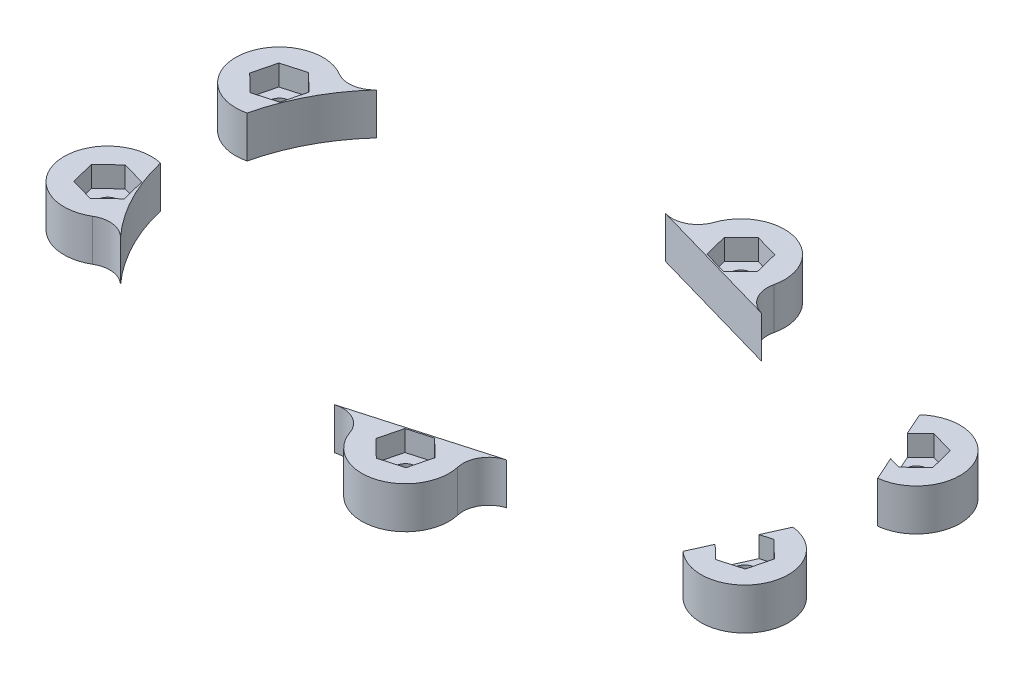
from build123d import *

# Parameters (mm, degrees)
SKETCH1_W               = 200
SKETCH1_H               = 150
SKETCH1_R               = 6
SKETCH1_R_2             = 13.5
SKETCH1_R_3             = 2
SKETCH1_R_4             = 2.5
BOSS_EXTRUDE1_DEPTH     = 4
SKETCH3_W               = 200
SKETCH3_H               = 150
BOSS_EXTRUDE2_DEPTH     = 8.25
SKETCH6_R               = 5.4
CUT_EXTRUDE2_DEPTH      = 8.25
FILLET1_R               = 2.5
FILLET2_R               = 5
SKETCH2_R               = 4.4
SKETCH2_R_2             = 5.4
CUT_EXTRUDE1_DEPTH      = 2
CUT_EXTRUDE3_DEPTH      = 126.598815828
CUT_EXTRUDE3_DEPTH_BACK = 126.598815828
SKETCH8_R               = 2
CUT_EXTRUDE6_DEPTH      = 126.598815818
CUT_EXTRUDE6_DEPTH_BACK = 126.598815818
SKETCH13_OUTSIDE_W      = 252.06
SKETCH13_OUTSIDE_H      = 202.06
FILLET4_R               = 5
CUT_EXTRUDE7_START      = -10.25
CUT_EXTRUDE7_DEPTH      = 10.25
SKETCH17_R              = 2
BOSS_EXTRUDE3_DEPTH     = 2
SKETCH18_R              = 13.5
SKETCH18_R_2            = 2
SKETCH18_R_3            = 2.5
SKETCH18_R_4            = 6
BOSS_EXTRUDE4_DEPTH     = 6
CUT_EXTRUDE8_DEPTH      = 92.336643939
CUT_EXTRUDE8_DEPTH_BACK = 92.336643939
SKETCH19_R              = 19.5
SKETCH19_R_2            = 0.75
CUT_EXTRUDE9_DEPTH      = 4
CUT_EXTRUDE10_DEPTH     = 4
SKETCH22_OUTSIDE_W      = 173.598
SKETCH22_OUTSIDE_H      = 115.598
CUT_EXTRUDE12_DEPTH     = 10


with BuildPart() as part:
    # Sketch1 → Boss-Extrude1 (new body)
    with BuildSketch(Plane(origin=(0, 0, 0), x_dir=(1, 0, 0), z_dir=(0, 1, 0))):
        Rectangle(SKETCH1_W, SKETCH1_H)
        with Locations(Location((35.5, 0, 0), (0, 0, 270))):
            Circle(SKETCH1_R, mode=Mode.SUBTRACT)
        with Locations(Location((-35.5, 0, 0), (0, 0, 270))):
            Circle(SKETCH1_R_2, mode=Mode.SUBTRACT)
        with Locations(Location((-60.5, 0, 0), (0, 0, 270))):
            Circle(SKETCH1_R_3, mode=Mode.SUBTRACT)
        with Locations(Location((-35.5, 25, 0), (0, 0, 270))):
            Circle(SKETCH1_R_3, mode=Mode.SUBTRACT)
        with Locations(Location((-10.5, 0, 0), (0, 0, 270))):
            Circle(SKETCH1_R_3, mode=Mode.SUBTRACT)
        with Locations(Location((-35.5, -25, 0), (0, 0, 270))):
            Circle(SKETCH1_R_3, mode=Mode.SUBTRACT)
        with Locations(Location((35.5, 18.5, 0), (0, 0, 270))):
            Circle(SKETCH1_R_4, mode=Mode.SUBTRACT)
        with Locations(Location((35.5, -18.5, 0), (0, 0, 90))):
            Circle(SKETCH1_R_4, mode=Mode.SUBTRACT)
        Polygon((4.517711304, -15.136418767), (0.159242352, 0.258507293), (4.681501882, 1.538807548), (9.039970835, -13.856118512), (9.584779454, -15.78048427), (5.062519924, -17.060784524), align=None, mode=Mode.SUBTRACT)
    extrude(amount=BOSS_EXTRUDE1_DEPTH)

    # Sketch3 → Boss-Extrude2 (add)
    with BuildSketch(Plane(origin=(0, 4, 0), x_dir=(1, 0, 0), z_dir=(0, 1, 0))):
        Rectangle(SKETCH3_W, SKETCH3_H)
        with BuildLine():
            Line((-26.573943662, 31.250208291), (39.070422535, 12.500083317))
            ThreePointArc((39.070422535, 12.500083317), (48.5, 0), (39.070422535, -12.500083317))
            Line((39.070422535, -12.500083317), (-26.573943662, -31.250208291))
            ThreePointArc((-26.573943662, -31.250208291), (-68, 0), (-26.573943662, 31.250208291))
        make_face(mode=Mode.SUBTRACT)
    extrude(amount=BOSS_EXTRUDE2_DEPTH)

    # Sketch6 → Cut-Extrude2 (cut)
    with BuildSketch(Plane(origin=(0, 12.25, 0), x_dir=(1, 0, 0), z_dir=(0, 1, 0))):
        with Locations((35.5, 18.5)):
            Circle(SKETCH6_R)
        with Locations((35.5, -18.5)):
            Circle(SKETCH6_R)
    extrude(amount=-CUT_EXTRUDE2_DEPTH, mode=Mode.SUBTRACT)

    # Fillet1
    # the kernel refuses this fillet: 2.5 mm, written as the material it adds along each edge
    with BuildSketch(Plane(origin=(9.584779454, 0, 15.78048427), x_dir=(-0.9621828787440704, 0, 0.2724043095323078), z_dir=(0, 1, 0)), Plane(origin=(5.062519924, 0, 17.060784524), x_dir=(-0.2724043095323296, 0, -0.9621828787440644), z_dir=(0, 1, 0)), Plane(origin=(4.681501882, 0, -1.538807548), x_dir=(0.2724043095323091, 0, 0.96218287874407), z_dir=(0, 1, 0))) as fillet1_piece_1:
        with BuildLine():
            CenterArc((FILLET1_R, -FILLET1_R), FILLET1_R, 90, 90)
            Line((0, -FILLET1_R), (0, 0))
            Line((0, 0), (FILLET1_R, 0))
        make_face()
    extrude(amount=4)
    with BuildSketch(Plane(origin=(0.159242352, 0, -0.258507293), x_dir=(0.272404309532306, 0, 0.962182878744071), z_dir=(0, 1, 0))) as fillet1_piece_2:
        with BuildLine():
            CenterArc((FILLET1_R, FILLET1_R), FILLET1_R, 180, 90)
            Line((0, FILLET1_R), (0, 0))
            Line((0, 0), (FILLET1_R, 0))
        make_face()
    extrude(amount=4)

    # Fillet2
    fillet2_edges = [part.edges().sort_by_distance(p)[0] for p in [
        (31.784909874, 8.125, 14.581058133),
        (36.584743308, 8.125, 13.210072594),
        (36.584743308, 8.125, -13.210072594),
        (31.784909874, 8.125, -14.581058133),
    ]]
    fillet(fillet2_edges, radius=FILLET2_R)

    # Sketch2 → Cut-Extrude1 (cut)
    with BuildSketch(Plane(origin=(0, 4, 0), x_dir=(1, 0, 0), z_dir=(0, 1, 0))):
        with Locations(Location((-35.5, 25, 0), (0, 0, 270))):
            Circle(SKETCH2_R)
        with Locations(Location((-10.5, 0, 0), (0, 0, 270))):
            Circle(SKETCH2_R)
        with Locations(Location((-35.5, -25, 0), (0, 0, 270))):
            Circle(SKETCH2_R)
        with Locations(Location((-60.5, 0, 0), (0, 0, 270))):
            Circle(SKETCH2_R)
        with Locations(Location((35.5, 18.5, 0), (0, 0, 270))):
            Circle(SKETCH2_R_2)
        with Locations(Location((35.5, -18.5, 0), (0, 0, 197.105868404))):
            Circle(SKETCH2_R_2)
    extrude(amount=-CUT_EXTRUDE1_DEPTH, mode=Mode.SUBTRACT)

    # Sketch8 → Cut-Extrude3 (cut, two sides: drawn at the far end of the back side and taken through both)
    with BuildSketch(Plane.XZ.offset(-CUT_EXTRUDE3_DEPTH_BACK)):
        with Locations(Location((49.5, 16.5, 0), (0, 0, 270))):
            Circle(SKETCH8_R)
        with Locations(Location((-73, 16.5, 0), (0, 0, 270))):
            Circle(SKETCH8_R)
        with Locations(Location((0, 32.25, 0), (0, 0, 270))):
            Circle(SKETCH8_R)
        with Locations(Location((-73, -16.5, 0), (0, 0, 270))):
            Circle(SKETCH8_R)
        with Locations(Location((0, -32.25, 0), (0, 0, 270))):
            Circle(SKETCH8_R)
        with Locations(Location((49.5, -16.5, 0), (0, 0, 270))):
            Circle(SKETCH8_R)
    extrude(amount=CUT_EXTRUDE3_DEPTH + CUT_EXTRUDE3_DEPTH_BACK, mode=Mode.SUBTRACT)

    # Sketch13 outside → Cut-Extrude6 (cut, two sides: drawn at the far end of the back side and taken through both)
    with BuildSketch(Plane(origin=(0, 12.25, 0), x_dir=(1, 0, 0), z_dir=(0, 1, 0)).offset(-CUT_EXTRUDE6_DEPTH_BACK)):
        Rectangle(SKETCH13_OUTSIDE_W, SKETCH13_OUTSIDE_H)
        with BuildLine():
            Line((-8.131291348, 30.142370761), (-25.475352113, 35.096387773))
            ThreePointArc((-25.475352113, 35.096387773), (-47.910899113, 34.325203324), (-65.651791262, 20.569868344))
            ThreePointArc((-65.651791262, 20.569868344), (-80.688646272, 19.88300436), (-71.036099712, 8.332803684))
            ThreePointArc((-71.036099712, 8.332803684), (-72, 0), (-71.036099712, -8.332803684))
            ThreePointArc((-71.036099712, -8.332803684), (-80.688646272, -19.88300436), (-65.651791262, -20.569868344))
            ThreePointArc((-65.651791262, -20.569868344), (-47.910899113, -34.325203324), (-25.475352113, -35.096387773))
            Line((-25.475352113, -35.096387773), (-8.131291348, -30.142370761))
            ThreePointArc((-8.131291348, -30.142370761), (2.307042254, -40.326976912), (5.791389082, -26.165609111))
            Line((5.791389082, -26.165609111), (25.285418022, -20.597492606))
            ThreePointArc((25.285418022, -20.597492606), (26.036864948, -20.680025145), (26.515828803, -21.264899257))
            ThreePointArc((26.515828803, -21.264899257), (34.700336728, -27.865924335), (43.885416553, -22.74791587))
            ThreePointArc((43.885416553, -22.74791587), (57.167099831, -19.931556524), (50.418811796, -8.150402112))
            ThreePointArc((50.418811796, -8.150402112), (52.5, 0), (50.418811796, 8.150402112))
            ThreePointArc((50.418811796, 8.150402112), (57.167099831, 19.931556524), (43.885416553, 22.74791587))
            ThreePointArc((43.885416553, 22.74791587), (34.700336728, 27.865924335), (26.515828803, 21.264899257))
            ThreePointArc((26.515828803, 21.264899257), (26.036864948, 20.680025145), (25.285418022, 20.597492606))
            Line((25.285418022, 20.597492606), (5.791389082, 26.165609111))
            ThreePointArc((5.791389082, 26.165609111), (2.307042254, 40.326976912), (-8.131291348, 30.142370761))
        make_face(mode=Mode.SUBTRACT)
    extrude(amount=CUT_EXTRUDE6_DEPTH + CUT_EXTRUDE6_DEPTH_BACK, mode=Mode.SUBTRACT)

    # Fillet4
    fillet4_edges = [part.edges().sort_by_distance(p)[0] for p in [
        (-65.651791262, 6.125, -20.569868344),
        (-8.131291348, 6.125, -30.142370761),
        (5.791389082, 6.125, -26.165609111),
        (5.791389082, 6.125, 26.165609111),
        (-8.131291348, 6.125, 30.142370761),
        (-65.651791262, 6.125, 20.569868344),
    ]]
    fillet(fillet4_edges, radius=FILLET4_R)

    # Sketch16 → Cut-Extrude7 (cut)
    with BuildSketch(Plane(origin=(0, 12.25, 0), x_dir=(1, 0, 0), z_dir=(0, 1, 0)).offset(CUT_EXTRUDE7_START)):
        with BuildLine():
            Line((-25.475352113, -35.096387773), (-14.034980843, -31.828652803))
            ThreePointArc((-14.034980843, -31.828652803), (-10.35487685, -32.200345605), (-7.937211031, -34.999669261))
            ThreePointArc((-7.937211031, -34.999669261), (2.307042254, -40.326976912), (8.192079949, -30.392629249))
            ThreePointArc((8.192079949, -30.392629249), (8.766483762, -26.738675062), (11.695078578, -24.479327069))
            Line((11.695078578, -24.479327069), (25.285418022, -20.597492606))
            ThreePointArc((25.285418022, -20.597492606), (26.036864948, -20.680025145), (26.515828803, -21.264899257))
            ThreePointArc((26.515828803, -21.264899257), (34.700336728, -27.865924335), (43.885416553, -22.74791587))
            ThreePointArc((43.885416553, -22.74791587), (57.167099831, -19.931556524), (50.418811796, -8.150402112))
            ThreePointArc((50.418811796, -8.150402112), (52.5, 0), (50.418811796, 8.150402112))
            ThreePointArc((50.418811796, 8.150402112), (57.167099831, 19.931556524), (43.885416553, 22.74791587))
            ThreePointArc((43.885416553, 22.74791587), (34.700336728, 27.865924335), (26.515828803, 21.264899257))
            ThreePointArc((26.515828803, 21.264899257), (26.036864948, 20.680025145), (25.285418022, 20.597492606))
            Line((25.285418022, 20.597492606), (11.695078578, 24.479327069))
            ThreePointArc((11.695078578, 24.479327069), (8.766483762, 26.738675062), (8.192079949, 30.392629249))
            ThreePointArc((8.192079949, 30.392629249), (2.307042254, 40.326976912), (-7.937211031, 34.999669261))
            ThreePointArc((-7.937211031, 34.999669261), (-10.35487685, 32.200345605), (-14.034980843, 31.828652803))
            Line((-14.034980843, 31.828652803), (-25.475352113, 35.096387773))
            ThreePointArc((-25.475352113, 35.096387773), (-45.44485792, 35.119080298), (-62.437574746, 24.629597374))
            ThreePointArc((-62.437574746, 24.629597374), (-65.401208588, 23.05656851), (-68.691961882, 23.711158546))
            ThreePointArc((-68.691961882, 23.711158546), (-81.304080467, 17.765799193), (-71.036099712, 8.332803684))
            ThreePointArc((-71.036099712, 8.332803684), (-72, 0), (-71.036099712, -8.332803684))
            ThreePointArc((-71.036099712, -8.332803684), (-81.304080467, -17.765799193), (-68.691961882, -23.711158546))
            ThreePointArc((-68.691961882, -23.711158546), (-65.401208588, -23.05656851), (-62.437574746, -24.629597374))
            ThreePointArc((-62.437574746, -24.629597374), (-45.44485792, -35.119080298), (-25.475352113, -35.096387773))
        make_face()
    extrude(amount=CUT_EXTRUDE7_DEPTH, mode=Mode.SUBTRACT)

    # Sketch17 → Boss-Extrude3 (add)
    with BuildSketch(Plane.XZ):
        with Locations((-10.5, 0)):
            Circle(SKETCH17_R)
        with Locations((-35.5, -25)):
            Circle(SKETCH17_R)
        with Locations((-35.5, 25)):
            Circle(SKETCH17_R)
        with Locations((-60.5, 0)):
            Circle(SKETCH17_R)
        with BuildLine():
            Line((4.38150915, 14.655327328), (0.840253126, 2.146949904))
            ThreePointArc((0.840253126, 2.146949904), (1.027633585, 0.312624087), (2.421599042, -0.894323694))
            ThreePointArc((2.421599042, -0.894323694), (4.241377267, -0.597221274), (5.362512656, 0.866649649))
            Line((5.362512656, 0.866649649), (8.90376868, 13.375027073))
            ThreePointArc((8.90376868, 13.375027073), (8.71638822, 15.209352889), (7.322422764, 16.41630067))
            ThreePointArc((7.322422764, 16.41630067), (5.502644538, 16.11919825), (4.38150915, 14.655327328))
        make_face()
    extrude(amount=-BOSS_EXTRUDE3_DEPTH)

    # Sketch18 → Boss-Extrude4 (add)
    with BuildSketch(Plane(origin=(0, 2, 0), x_dir=(1, 0, 0), z_dir=(0, 1, 0))):
        with BuildLine():
            Line((-25.475352113, -35.096387773), (-14.034980843, -31.828652803))
            ThreePointArc((-14.034980843, -31.828652803), (-10.35487685, -32.200345605), (-7.937211031, -34.999669261))
            ThreePointArc((-7.937211031, -34.999669261), (2.307042254, -40.326976912), (8.192079949, -30.392629249))
            ThreePointArc((8.192079949, -30.392629249), (8.766483762, -26.738675062), (11.695078578, -24.479327069))
            Line((11.695078578, -24.479327069), (25.285418022, -20.597492606))
            ThreePointArc((25.285418022, -20.597492606), (26.036864948, -20.680025145), (26.515828803, -21.264899257))
            ThreePointArc((26.515828803, -21.264899257), (34.700336728, -27.865924335), (43.885416553, -22.74791587))
            ThreePointArc((43.885416553, -22.74791587), (57.167099831, -19.931556524), (50.418811796, -8.150402112))
            ThreePointArc((50.418811796, -8.150402112), (52.5, 0), (50.418811796, 8.150402112))
            ThreePointArc((50.418811796, 8.150402112), (57.167099831, 19.931556524), (43.885416553, 22.74791587))
            ThreePointArc((43.885416553, 22.74791587), (34.700336728, 27.865924335), (26.515828803, 21.264899257))
            ThreePointArc((26.515828803, 21.264899257), (26.036864948, 20.680025145), (25.285418022, 20.597492606))
            Line((25.285418022, 20.597492606), (11.695078578, 24.479327069))
            ThreePointArc((11.695078578, 24.479327069), (8.766483762, 26.738675062), (8.192079949, 30.392629249))
            ThreePointArc((8.192079949, 30.392629249), (2.307042254, 40.326976912), (-7.937211031, 34.999669261))
            ThreePointArc((-7.937211031, 34.999669261), (-10.35487685, 32.200345605), (-14.034980843, 31.828652803))
            Line((-14.034980843, 31.828652803), (-25.475352113, 35.096387773))
            ThreePointArc((-25.475352113, 35.096387773), (-45.44485792, 35.119080298), (-62.437574746, 24.629597374))
            ThreePointArc((-62.437574746, 24.629597374), (-65.401208588, 23.05656851), (-68.691961882, 23.711158546))
            ThreePointArc((-68.691961882, 23.711158546), (-81.304080467, 17.765799193), (-71.036099712, 8.332803684))
            ThreePointArc((-71.036099712, 8.332803684), (-72, 0), (-71.036099712, -8.332803684))
            ThreePointArc((-71.036099712, -8.332803684), (-81.304080467, -17.765799193), (-68.691961882, -23.711158546))
            ThreePointArc((-68.691961882, -23.711158546), (-65.401208588, -23.05656851), (-62.437574746, -24.629597374))
            ThreePointArc((-62.437574746, -24.629597374), (-45.44485792, -35.119080298), (-25.475352113, -35.096387773))
        make_face()
        with Locations(Location((-35.5, 0, 0), (0, 0, 270))):
            Circle(SKETCH18_R, mode=Mode.SUBTRACT)
        with Locations(Location((0, 32.25, 0), (0, 0, 90))):
            Circle(SKETCH18_R_2, mode=Mode.SUBTRACT)
        with Locations(Location((-73, 16.5, 0), (0, 0, 90))):
            Circle(SKETCH18_R_2, mode=Mode.SUBTRACT)
        with Locations(Location((-73, -16.5, 0), (0, 0, 90))):
            Circle(SKETCH18_R_2, mode=Mode.SUBTRACT)
        with Locations(Location((0, -32.25, 0), (0, 0, 90))):
            Circle(SKETCH18_R_2, mode=Mode.SUBTRACT)
        with Locations(Location((35.5, -18.5, 0), (0, 0, 90))):
            Circle(SKETCH18_R_3, mode=Mode.SUBTRACT)
        with Locations(Location((35.5, 0, 0), (0, 0, 270))):
            Circle(SKETCH18_R_4, mode=Mode.SUBTRACT)
        with Locations(Location((49.5, -16.5, 0), (0, 0, 90))):
            Circle(SKETCH18_R_2, mode=Mode.SUBTRACT)
        with Locations(Location((35.5, 18.5, 0), (0, 0, 270))):
            Circle(SKETCH18_R_3, mode=Mode.SUBTRACT)
        with Locations(Location((49.5, 16.5, 0), (0, 0, 90))):
            Circle(SKETCH18_R_2, mode=Mode.SUBTRACT)
    extrude(amount=BOSS_EXTRUDE4_DEPTH)

    # Sketch19 → Cut-Extrude8 (cut, two sides: drawn at the far end of the back side and taken through both)
    with BuildSketch(Plane.XZ.offset(-CUT_EXTRUDE8_DEPTH_BACK)):
        with Locations(Location((-35.5, 0, 0), (0, 0, 270))):
            Circle(SKETCH19_R)
        with Locations(Location((35.5, 9.525, 0), (0, 0, 270))):
            Circle(SKETCH19_R_2)
        with Locations(Location((35.5, -9.525, 0), (0, 0, 270))):
            Circle(SKETCH19_R_2)
    extrude(amount=CUT_EXTRUDE8_DEPTH + CUT_EXTRUDE8_DEPTH_BACK, mode=Mode.SUBTRACT)

    # Sketch20 → Cut-Extrude9 (cut)
    with BuildSketch(Plane.XZ):
        Polygon((40.118802154, 18.5), (37.809401077, 22.5), (33.190598923, 22.5), (30.881197846, 18.5), (33.190598923, 14.5), (37.809401077, 14.5), align=None)
        Polygon((40.118802154, -18.5), (37.809401077, -14.5), (33.190598923, -14.5), (30.881197846, -18.5), (33.190598923, -22.5), (37.809401077, -22.5), align=None)
    extrude(amount=-CUT_EXTRUDE9_DEPTH, mode=Mode.SUBTRACT)

    # Sketch21 → Cut-Extrude10 (cut)
    with BuildSketch(Plane(origin=(0, 8, 0), x_dir=(1, 0, 0), z_dir=(0, 1, 0))):
        Polygon((-69.680815691, 13.288092645), (-68.558814481, 17.768544253), (-71.87799879, 20.980451609), (-76.319184309, 19.711907355), (-77.441185519, 15.231455747), (-74.12200121, 12.019548391), align=None)
        Polygon((-69.680815691, -13.288092645), (-74.12200121, -12.019548391), (-77.441185519, -15.231455747), (-76.319184309, -19.711907355), (-71.87799879, -20.980451609), (-68.558814481, -17.768544253), align=None)
        Polygon((4.441185519, 30.981455747), (3.319184309, 35.461907355), (-1.12200121, 36.730451609), (-4.441185519, 33.518544253), (-3.319184309, 29.038092645), (1.12200121, 27.769548391), align=None)
        Polygon((50.62200121, 12.019548391), (53.941185519, 15.231455747), (52.819184309, 19.711907355), (48.37799879, 20.980451609), (45.058814481, 17.768544253), (46.180815691, 13.288092645), align=None)
        Polygon((53.941185519, -15.231455747), (50.62200121, -12.019548391), (46.180815691, -13.288092645), (45.058814481, -17.768544253), (48.37799879, -20.980451609), (52.819184309, -19.711907355), align=None)
        Polygon((4.441185519, -30.981455747), (1.12200121, -27.769548391), (-3.319184309, -29.038092645), (-4.441185519, -33.518544253), (-1.12200121, -36.730451609), (3.319184309, -35.461907355), align=None)
    extrude(amount=-CUT_EXTRUDE10_DEPTH, mode=Mode.SUBTRACT)

    # Sketch22 outside → Cut-Extrude12 (cut)
    with BuildSketch(Plane.XZ):
        with Locations((-11.75, 0)):
            Rectangle(SKETCH22_OUTSIDE_W, SKETCH22_OUTSIDE_H)
        with BuildLine():
            Line((-14.034980843, 31.828652803), (11.695078578, 24.479327069))
            ThreePointArc((11.695078578, 24.479327069), (8.766483762, 26.738675062), (8.192079949, 30.392629249))
            ThreePointArc((8.192079949, 30.392629249), (2.307042254, 40.326976912), (-7.937211031, 34.999669261))
            ThreePointArc((-7.937211031, 34.999669261), (-10.35487685, 32.200345605), (-14.034980843, 31.828652803))
        make_face(mode=Mode.SUBTRACT)
        with BuildLine():
            Line((-14.034980843, -31.828652803), (11.695078578, -24.479327069))
            ThreePointArc((11.695078578, -24.479327069), (8.766483762, -26.738675062), (8.192079949, -30.392629249))
            ThreePointArc((8.192079949, -30.392629249), (2.307042254, -40.326976912), (-7.937211031, -34.999669261))
            ThreePointArc((-7.937211031, -34.999669261), (-10.35487685, -32.200345605), (-14.034980843, -31.828652803))
        make_face(mode=Mode.SUBTRACT)
        with BuildLine():
            Line((43.885416553, 22.74791587), (50.418811796, 8.150402112))
            ThreePointArc((50.418811796, 8.150402112), (57.167099831, 19.931556524), (43.885416553, 22.74791587))
        make_face(mode=Mode.SUBTRACT)
        with BuildLine():
            Line((50.418811796, -8.150402112), (43.885416553, -22.74791587))
            ThreePointArc((43.885416553, -22.74791587), (57.167099831, -19.931556524), (50.418811796, -8.150402112))
        make_face(mode=Mode.SUBTRACT)
        with BuildLine():
            ThreePointArc((-62.437574746, 24.629597374), (-67.78213703, 17.032722295), (-71.036099712, 8.332803684))
            ThreePointArc((-71.036099712, 8.332803684), (-81.304080467, 17.765799193), (-68.691961882, 23.711158546))
            ThreePointArc((-68.691961882, 23.711158546), (-65.401208588, 23.05656851), (-62.437574746, 24.629597374))
        make_face(mode=Mode.SUBTRACT)
        with BuildLine():
            ThreePointArc((-71.036099712, -8.332803684), (-67.78213703, -17.032722295), (-62.437574746, -24.629597374))
            ThreePointArc((-62.437574746, -24.629597374), (-65.401208588, -23.05656851), (-68.691961882, -23.711158546))
            ThreePointArc((-68.691961882, -23.711158546), (-81.304080467, -17.765799193), (-71.036099712, -8.332803684))
        make_face(mode=Mode.SUBTRACT)
    extrude(amount=-CUT_EXTRUDE12_DEPTH, mode=Mode.SUBTRACT)


with BuildPart() as cut_extrude12_piece_1:
    # of the separate pieces the step leaves, piece 1, a body of its own (cut_extrude12_pieces)
    add(part.part.solids().sort_by_distance((11.695078578, 0, 24.479327069))[0])


with BuildPart() as cut_extrude12_piece_2:
    # of the separate pieces the step leaves, piece 2, a body of its own (cut_extrude12_pieces)
    add(part.part.solids().sort_by_distance((8.192079949, 0, -30.392629249))[0])


with BuildPart() as cut_extrude12_piece_3:
    # of the separate pieces the step leaves, piece 3, a body of its own (cut_extrude12_pieces)
    add(part.part.solids().sort_by_distance((-68.691961882, 0, -23.711158546))[0])


with BuildPart() as cut_extrude12_piece_4:
    # of the separate pieces the step leaves, piece 4, a body of its own (cut_extrude12_pieces)
    add(part.part.solids().sort_by_distance((-68.691961882, 0, 23.711158546))[0])


with BuildPart() as cut_extrude12_piece_5:
    # of the separate pieces the step leaves, piece 5, a body of its own (cut_extrude12_pieces)
    add(part.part.solids().sort_by_distance((43.885416553, 0, 22.74791587))[0])


with BuildPart() as cut_extrude12_piece_6:
    # of the separate pieces the step leaves, piece 6, a body of its own (cut_extrude12_pieces)
    add(part.part.solids().sort_by_distance((50.418811796, 0, -8.150402112))[0])


solid = Compound([cut_extrude12_piece_1.part, cut_extrude12_piece_2.part, cut_extrude12_piece_3.part, cut_extrude12_piece_4.part, cut_extrude12_piece_5.part, cut_extrude12_piece_6.part])
